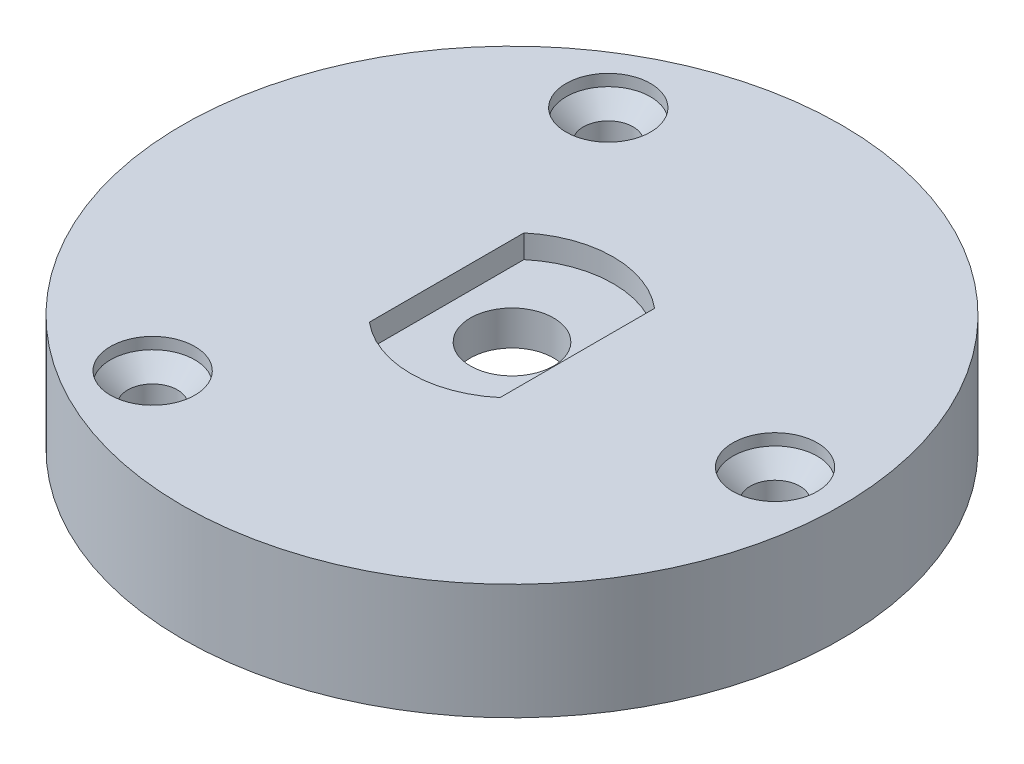
from build123d import *

# Parameters (mm, degrees)
SKETCH_714_R           = 3.6
CUT_EXTRUDE_1503_DEPTH = 2
CUT_EXTRUDE_1558_DEPTH = 4
SKETCH_1765_R          = 2.15
CUT_EXTRUDE_2399_DEPTH = 42.527099586
SKETCH_3_5_R           = 3.65
CUT_EXTRUDE_2433_DEPTH = 0.5
CHAMFER_3010_SIZE      = 2


with BuildPart() as part:
    # Sketch 314 → Повернуть1 (revolve)
    with BuildSketch(Plane.XY, mode=Mode.PRIVATE) as revolve_1_sk:
        Polygon((3.6, 10), (28.5, 10), (28.5, 0), (17.15, 0), (17.15, 5), (3.6, 5), align=None)
    revolve(revolve_1_sk.sketch.rotate(Axis((0, 24.786794377, 0), (0, -1, 0)), 90), axis=Axis((0, 24.786794377, 0), (0, -1, 0)))

    # Sketch 714 → Cut-Extrude 1503 (cut)
    # profile 1 of 2: a face of its own
    with BuildSketch(Plane(origin=(0, 10, 0), x_dir=(1, 0, 0), z_dir=(0, 1, 0))):
        with BuildLine():
            ThreePointArc((-1.5, -7.78), (-1.330121933, -7.369878067), (-0.92, -7.2))
            Line((-0.92, -7.2), (0.92, -7.2))
            ThreePointArc((0.92, -7.2), (1.330121933, -7.369878067), (1.5, -7.78))
            Line((1.5, -7.78), (1.5, -8.082233602))
            ThreePointArc((1.5, -8.082233602), (1.341523495, -8.496233679), (0.947109471, -8.6985909))
            ThreePointArc((0.947109471, -8.6985909), (3.449320455, -8.041435717), (5.65, -6.681317235))
            Line((5.65, -6.681317235), (5.65, 6.681317235))
            ThreePointArc((5.65, 6.681317235), (0, 8.75), (-5.65, 6.681317235))
            Line((-5.65, 6.681317235), (-5.65, -6.681317235))
            ThreePointArc((-5.65, -6.681317235), (-3.449320455, -8.041435717), (-0.947109471, -8.6985909))
            ThreePointArc((-0.947109471, -8.6985909), (-1.341523495, -8.496233679), (-1.5, -8.082233602))
            Line((-1.5, -8.082233602), (-1.5, -7.78))
        make_face()
        with Locations(Location((0, 0, 0), (0, 0, 270))):
            Circle(SKETCH_714_R, mode=Mode.SUBTRACT)
    # profile 2 of 2: a face of its own
    with BuildSketch(Plane(origin=(0, 10, 0), x_dir=(1, 0, 0), z_dir=(0, 1, 0))):
        with BuildLine():
            ThreePointArc((-1.5, -7.78), (-1.330121933, -7.369878067), (-0.92, -7.2))
            Line((-0.92, -7.2), (0.92, -7.2))
            ThreePointArc((0.92, -7.2), (1.330121933, -7.369878067), (1.5, -7.78))
            Line((1.5, -7.78), (1.5, -8.082233602))
            ThreePointArc((1.5, -8.082233602), (1.341523495, -8.496233679), (0.947109471, -8.6985909))
            ThreePointArc((0.947109471, -8.6985909), (0, -8.75), (-0.947109471, -8.6985909))
            ThreePointArc((-0.947109471, -8.6985909), (-1.341523495, -8.496233679), (-1.5, -8.082233602))
            Line((-1.5, -8.082233602), (-1.5, -7.78))
        make_face()
    extrude(amount=-CUT_EXTRUDE_1503_DEPTH, mode=Mode.SUBTRACT)

    # Эскиз2<3> → Cut-Extrude 1558 (cut)
    with BuildSketch(Plane(origin=(0, 10, 0), x_dir=(1, 0, 0), z_dir=(0, 1, 0))):
        with BuildLine():
            ThreePointArc((-1.5, -7.78), (-1.330121933, -7.369878067), (-0.92, -7.2))
            Line((-0.92, -7.2), (0.92, -7.2))
            ThreePointArc((0.92, -7.2), (1.330121933, -7.369878067), (1.5, -7.78))
            Line((1.5, -7.78), (1.5, -8.082233602))
            ThreePointArc((1.5, -8.082233602), (1.341523495, -8.496233679), (0.947109471, -8.6985909))
            ThreePointArc((0.947109471, -8.6985909), (0, -8.75), (-0.947109471, -8.6985909))
            ThreePointArc((-0.947109471, -8.6985909), (-1.341523495, -8.496233679), (-1.5, -8.082233602))
            Line((-1.5, -8.082233602), (-1.5, -7.78))
        make_face()
    extrude(amount=-CUT_EXTRUDE_1558_DEPTH, mode=Mode.SUBTRACT)

    # Sketch 1765 → Cut-Extrude 2399 (cut, through all)
    with BuildSketch(Plane(origin=(0, 10, 0), x_dir=(1, 0, 0), z_dir=(0, 1, 0))):
        with Locations(Location((22.75, 0, 0), (0, 0, 270))):
            Circle(SKETCH_1765_R)
        with Locations(Location((-11.375, -19.702077936, 0), (0, 0, 270))):
            Circle(SKETCH_1765_R)
        with Locations(Location((-11.375, 19.702077936, 0), (0, 0, 270))):
            Circle(SKETCH_1765_R)
    extrude(amount=-CUT_EXTRUDE_2399_DEPTH, mode=Mode.SUBTRACT)

    # Эскиз3<5> → Cut-Extrude 2433 (cut)
    with BuildSketch(Plane(origin=(0, 10, 0), x_dir=(1, 0, 0), z_dir=(0, 1, 0))):
        with Locations(Location((22.75, 0, 0), (0, 0, 270))):
            Circle(SKETCH_3_5_R)
        with Locations(Location((-11.375, -19.702077936, 0), (0, 0, 270))):
            Circle(SKETCH_3_5_R)
        with Locations(Location((-11.375, 19.702077936, 0), (0, 0, 270))):
            Circle(SKETCH_3_5_R)
    extrude(amount=-CUT_EXTRUDE_2433_DEPTH, mode=Mode.SUBTRACT)

    # Chamfer 3010
    # the kernel refuses this chamfer: 2 mm, written as the material it takes off along each edge
    with BuildSketch(Plane(origin=(-11.375, 9.5, -19.702077936), x_dir=(0, 0, 1), z_dir=(-1, 0, 0))) as chamfer_3010_piece_1_section:
        Polygon((2.15 + CHAMFER_3010_SIZE, 0), (2.15, -CHAMFER_3010_SIZE), (2.15, 0), align=None)
    chamfer_3010_piece_1 = revolve(axis=Axis((-11.375, 9.5, -19.702077936), (0, 1, 0)), mode=Mode.PRIVATE)
    chamfer_3010_piece_1 = chamfer_3010_piece_1 & Plane(origin=(-11.375, 8.244810857, -19.702077936), x_dir=(0, 0, 1), z_dir=(0, 1, 0)) * Cylinder(3.65, 17, mode=Mode.PRIVATE)
    add(chamfer_3010_piece_1, mode=Mode.SUBTRACT)
    with BuildSketch(Plane(origin=(22.75, 9.5, 0), x_dir=(0, 0, 1), z_dir=(-1, 0, 0))) as chamfer_3010_piece_2_section:
        Polygon((2.15 + CHAMFER_3010_SIZE, 0), (2.15, -CHAMFER_3010_SIZE), (2.15, 0), align=None)
    chamfer_3010_piece_2 = revolve(axis=Axis((22.75, 9.5, 0), (0, 1, 0)), mode=Mode.PRIVATE)
    chamfer_3010_piece_2 = chamfer_3010_piece_2 & Plane(origin=(22.75, 8.244810857, 0), x_dir=(0, 0, 1), z_dir=(0, 1, 0)) * Cylinder(3.65, 17, mode=Mode.PRIVATE)
    add(chamfer_3010_piece_2, mode=Mode.SUBTRACT)
    with BuildSketch(Plane(origin=(-11.375, 9.5, 19.702077936), x_dir=(0, 0, 1), z_dir=(-1, 0, 0))) as chamfer_3010_piece_3_section:
        Polygon((2.15 + CHAMFER_3010_SIZE, 0), (2.15, -CHAMFER_3010_SIZE), (2.15, 0), align=None)
    chamfer_3010_piece_3 = revolve(axis=Axis((-11.375, 9.5, 19.702077936), (0, 1, 0)), mode=Mode.PRIVATE)
    chamfer_3010_piece_3 = chamfer_3010_piece_3 & Plane(origin=(-11.375, 8.244810857, 19.702077936), x_dir=(0, 0, 1), z_dir=(0, 1, 0)) * Cylinder(3.65, 17, mode=Mode.PRIVATE)
    add(chamfer_3010_piece_3, mode=Mode.SUBTRACT)


solid = part.part
